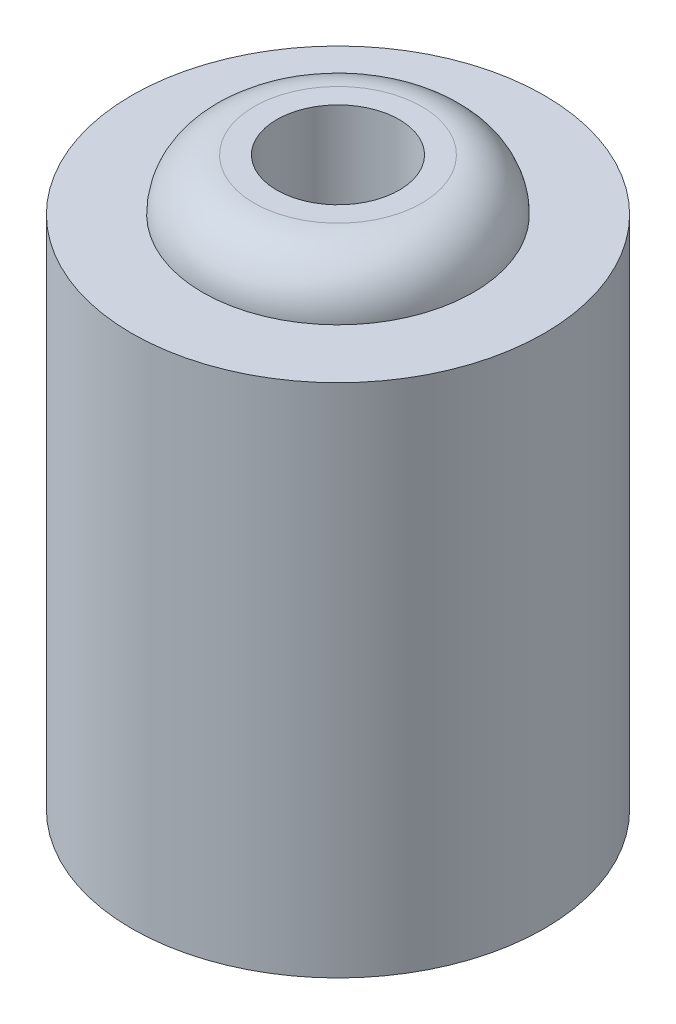
from build123d import *

# Parameters (mm, degrees)
SKETCH1_R           = 8
SKETCH1_R_2         = 2.375
BOSS_EXTRUDE1_DEPTH = 20
SKETCH2_R           = 5.25
SKETCH2_R_2         = 2.375
BOSS_EXTRUDE2_DEPTH = 2
FILLET1_R           = 2


with BuildPart() as part:
    # Sketch1 → Boss-Extrude1 (new body)
    with BuildSketch(Plane(origin=(0, 0, 0), x_dir=(1, 0, 0), z_dir=(0, 1, 0))):
        with Locations(Location((0, 0, 0), (0, 0, 270))):
            Circle(SKETCH1_R)
        with Locations(Location((0, 0, 0), (0, 0, 270))):
            Circle(SKETCH1_R_2, mode=Mode.SUBTRACT)
    extrude(amount=BOSS_EXTRUDE1_DEPTH)

    # Sketch2 → Boss-Extrude2 (add)
    with BuildSketch(Plane(origin=(0, 20, 0), x_dir=(1, 0, 0), z_dir=(0, 1, 0))):
        with Locations(Location((0, 0, 0), (0, 0, 270))):
            Circle(SKETCH2_R)
        with Locations(Location((0, 0, 0), (0, 0, 270))):
            Circle(SKETCH2_R_2, mode=Mode.SUBTRACT)
    extrude(amount=BOSS_EXTRUDE2_DEPTH)

    # Fillet1
    fillet1_edges = [part.edges().sort_by_distance(p)[0] for p in [
        (0, 22, -5.25),
    ]]
    fillet(fillet1_edges, radius=FILLET1_R - 0.0001)  # a hair under: the kernel refuses the full size


solid = part.part
